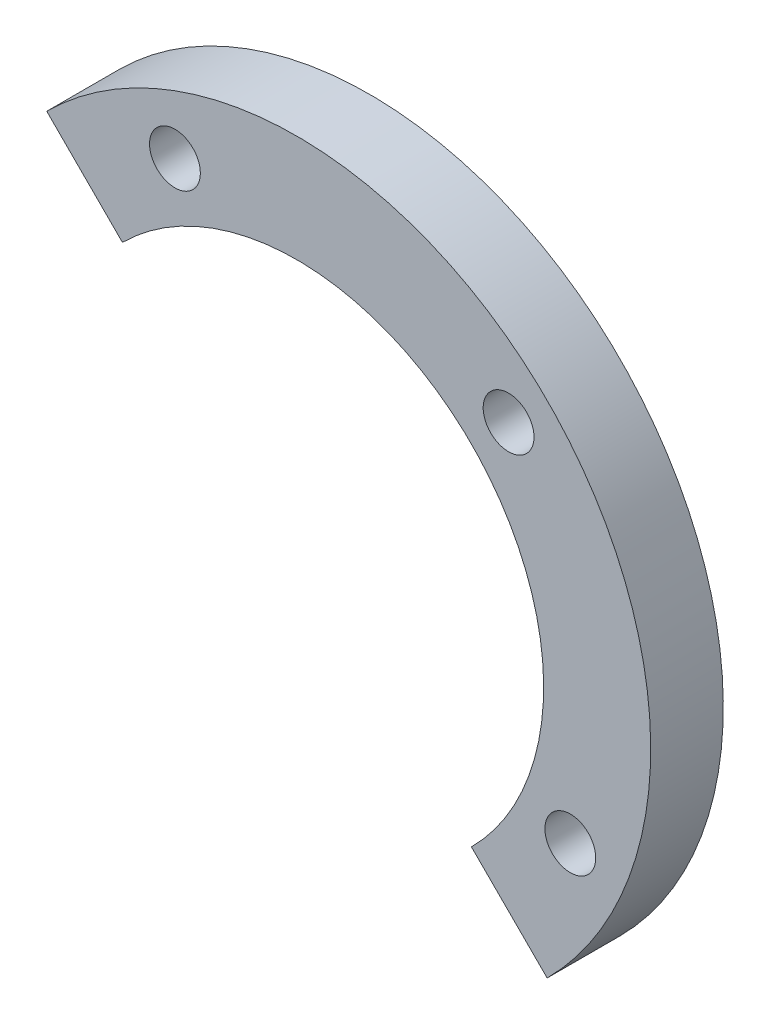
from build123d import *

# Parameters (mm, degrees)
SKETCH1_R      = 1.4
SHAPE_DEPTH    = 4
SKETCH2_R      = 1
NUT_CUTS_DEPTH = 2


with BuildPart() as part:
    # Sketch1 → Shape (new body)
    with BuildSketch(Plane.XY):
        with BuildLine():
            Line((74.619512195, 55.386208598), (78.792682927, 51.21551968))
            ThreePointArc((78.792682927, 51.21551968), (78.788582233, 78.788582233), (51.21551968, 78.792682927))
            Line((51.21551968, 78.792682927), (55.386208598, 74.619512195))
            ThreePointArc((55.386208598, 74.619512195), (70.206363267, 77.563987486), (78.6, 65))
            ThreePointArc((78.6, 65), (77.565535521, 59.797374021), (74.619512195, 55.386208598))
        make_face()
        with Locations((80.069797048, 58.280534476)):
            Circle(SKETCH1_R, mode=Mode.SUBTRACT)
        with Locations((58.280534476, 80.069797048)):
            Circle(SKETCH1_R, mode=Mode.SUBTRACT)
        with Locations((76.66726189, 76.66726189)):
            Circle(SKETCH1_R, mode=Mode.SUBTRACT)
    extrude(amount=SHAPE_DEPTH)

    # Sketch2 → Nut cuts (cut)
    with BuildSketch(Plane.XY):
        with Locations((56.557324788, 79.301435799)):
            Circle(SKETCH2_R)
        with Locations((56.75350927, 81.17795979)):
            Circle(SKETCH2_R)
        with Locations((58.476718959, 81.94632104)):
            Circle(SKETCH2_R)
        with Locations((60.003744165, 80.838158298)):
            Circle(SKETCH2_R)
        with Locations((59.807559682, 78.961634307)):
            Circle(SKETCH2_R)
        with Locations((58.084349994, 78.193273057)):
            Circle(SKETCH2_R)
        Polygon((60.917065198, 81.245398633), (58.580699, 82.940900424), (55.944168278, 81.765298839), (55.644003754, 78.894195464), (57.980369952, 77.198693673), (60.616900674, 78.374295257), align=None)
    extrude(amount=NUT_CUTS_DEPTH, mode=Mode.SUBTRACT)


solid = part.part
